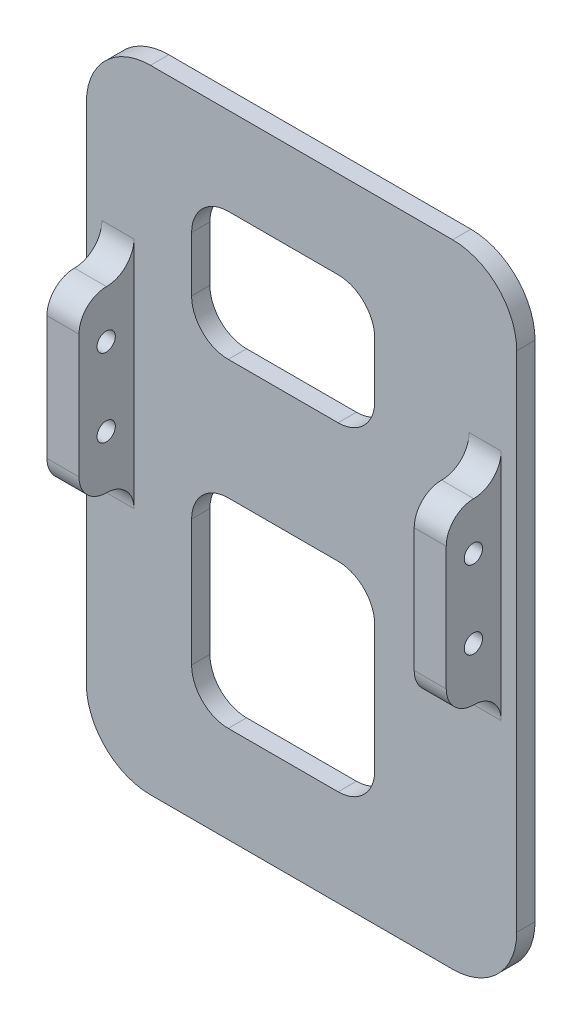
from build123d import *

# Parameters (mm, degrees)
SKETCH1_W           = 47
SKETCH1_H           = 69
BOSS_EXTRUDE1_DEPTH = 2
FILLET1_R           = 7
SKETCH2_W           = 20
SKETCH2_H           = 14
SKETCH2_H_2         = 21.8
CUT_EXTRUDE1_DEPTH  = 2
FILLET2_R           = 4
SKETCH4_W           = 3.5
SKETCH4_H           = 19.5
BOSS_EXTRUDE2_DEPTH = 6
FILLET3_START       = -210.696929932
FILLET3_DEPTH       = 43.606418674
FILLET3_2_DEPTH     = 3.5
FILLET3_START_2     = -170.590511258
FILLET3_3_DEPTH     = 3.5
SKETCH5_R           = 1
CUT_EXTRUDE2_DEPTH  = 445.178336025


with BuildPart() as part:
    # Sketch1 → Boss-Extrude1 (new body)
    with BuildSketch(Plane.XY.offset(10)):
        with Locations((-188.893720595, 406.995202033)):
            Rectangle(SKETCH1_W, SKETCH1_H)
    extrude(amount=BOSS_EXTRUDE1_DEPTH)

    # Fillet1
    fillet1_edges = [part.edges().sort_by_distance(p)[0] for p in [
        (-212.393720595, 441.495202033, 11),
        (-165.393720595, 441.495202033, 11),
        (-165.393720595, 372.495202033, 11),
        (-212.393720595, 372.495202033, 11),
    ]]
    fillet(fillet1_edges, radius=FILLET1_R)

    # Sketch2 → Cut-Extrude1 (cut)
    with BuildSketch(Plane.XY.offset(12)):
        with Locations((-190.900590621, 424.93058769)):
            Rectangle(SKETCH2_W, SKETCH2_H)
        with Locations((-190.900590621, 393.92847215)):
            Rectangle(SKETCH2_W, SKETCH2_H_2)
    extrude(amount=-CUT_EXTRUDE1_DEPTH, mode=Mode.SUBTRACT)

    # Fillet2
    fillet2_edges = [part.edges().sort_by_distance(p)[0] for p in [
        (-200.900590621, 417.93058769, 11),
        (-200.900590621, 431.93058769, 11),
        (-180.900590621, 431.93058769, 11),
        (-180.900590621, 417.93058769, 11),
        (-200.900590621, 383.02847215, 11),
        (-200.900590621, 404.82847215, 11),
        (-180.900590621, 404.82847215, 11),
        (-180.900590621, 383.02847215, 11),
    ]]
    fillet(fillet2_edges, radius=FILLET2_R)

    # Sketch4 → Boss-Extrude2 (add)
    with BuildSketch(Plane.XY.offset(12)):
        with Locations((-168.840511258, 411.411865234)):
            Rectangle(SKETCH4_W, SKETCH4_H)
        with Locations((-208.946929932, 411.411865234)):
            Rectangle(SKETCH4_W, SKETCH4_H)
    extrude(amount=BOSS_EXTRUDE2_DEPTH)

    # Fillet3: read off the stored shape, not the designer's step
    # Fillet3 outline → Fillet3 (cut)
    with BuildSketch(Plane.YZ.offset(FILLET3_START)):
        with BuildLine():
            ThreePointArc((418.161865234, 18), (420.283185578, 17.121320344), (421.161865234, 15))
            Line((421.161865234, 15), (421.161865234, 18))
            Line((421.161865234, 18), (418.161865234, 18))
        make_face()
        with BuildLine():
            ThreePointArc((401.661865234, 15), (402.540544891, 17.121320343), (404.661865234, 18))
            Line((404.661865234, 18), (401.661865234, 18))
            Line((401.661865234, 18), (401.661865234, 15))
        make_face()
    extrude(amount=FILLET3_DEPTH, mode=Mode.SUBTRACT)

    # Fillet3 2 outline → Fillet3 2 (add)
    with BuildSketch(Plane.YZ.offset(FILLET3_START)):
        with BuildLine():
            Line((421.161865234, 12), (424.161865234, 12))
            ThreePointArc((424.161865234, 12), (422.040544891, 12.878679657), (421.161865234, 15))
            Line((421.161865234, 15), (421.161865234, 12))
        make_face()
        with BuildLine():
            Line((398.661865234, 12), (401.661865234, 12))
            Line((401.661865234, 12), (401.661865234, 15))
            ThreePointArc((401.661865234, 15), (400.783185578, 12.878679656), (398.661865234, 12))
        make_face()
    extrude(amount=FILLET3_2_DEPTH)

    # Fillet3 3 outline → Fillet3 3 (add)
    with BuildSketch(Plane.YZ.offset(FILLET3_START_2)):
        with BuildLine():
            Line((421.161865234, 12), (424.161865234, 12))
            ThreePointArc((424.161865234, 12), (422.040544891, 12.878679657), (421.161865234, 15))
            Line((421.161865234, 15), (421.161865234, 12))
        make_face()
        with BuildLine():
            Line((398.661865234, 12), (401.661865234, 12))
            Line((401.661865234, 12), (401.661865234, 15))
            ThreePointArc((401.661865234, 15), (400.783185578, 12.878679656), (398.661865234, 12))
        make_face()
    extrude(amount=FILLET3_3_DEPTH)

    # Sketch5 → Cut-Extrude2 (cut, through all)
    with BuildSketch(Plane(origin=(-167.090511258, 0, 0), x_dir=(0, 0, -1), z_dir=(1, 0, 0))):
        with Locations((-15.033399781, 407.479533559)):
            Circle(SKETCH5_R)
        with Locations((-15.033399781, 415.979533559)):
            Circle(SKETCH5_R)
    extrude(amount=-CUT_EXTRUDE2_DEPTH, mode=Mode.SUBTRACT)


solid = part.part
